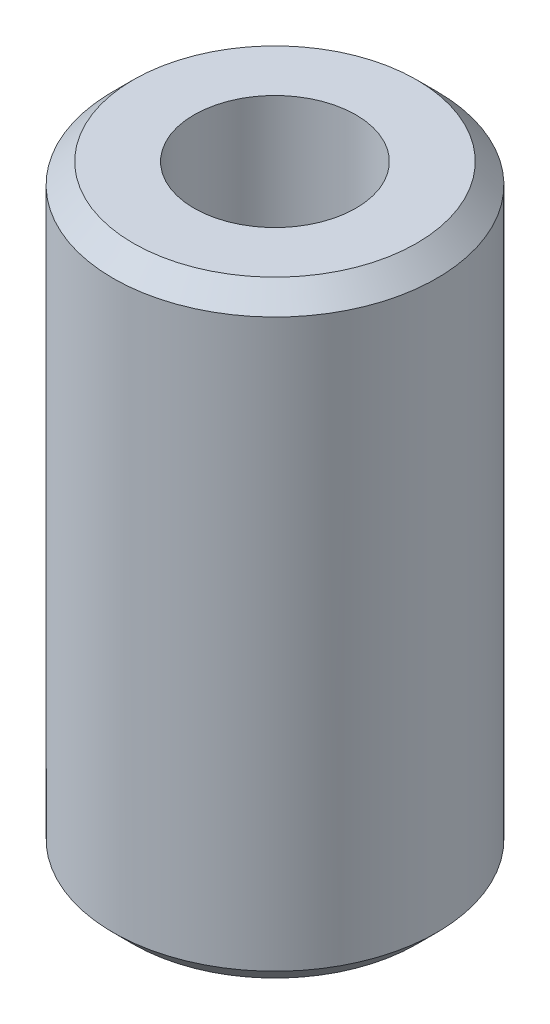
from build123d import *

# Parameters (mm, degrees)
CHAMFER_1_SIZE = 1


with BuildPart() as part:
    # Эскиз1 → Повернуть1 (revolve)
    with BuildSketch(Plane.XY):
        Polygon((8, 0), (8, 30), (4, 30), (4, 20), (1, 17), (1, 13), (4, 10), (4, 0), align=None)
    revolve(axis=Axis((0, 0, 0), (0, 1, 0)))

    # Фаска1
    chamfer_1_edges = [part.edges().sort_by_distance(p)[0] for p in [
        (-8, 30, 0),
        (-8, 0, 0),
    ]]
    chamfer(chamfer_1_edges, length=CHAMFER_1_SIZE)


solid = part.part
